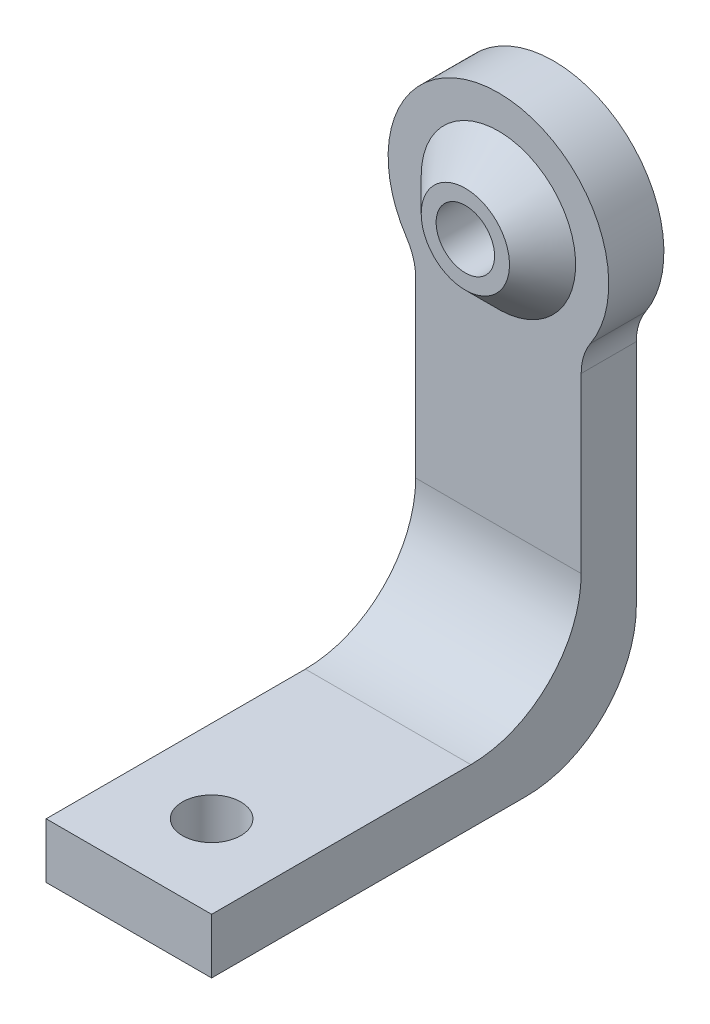
from build123d import *

# Parameters (mm, degrees)
BOSS_EXTRUDE5_DEPTH      = 7.5
BOSS_EXTRUDE5_DEPTH_BACK = 7.5
SKETCH8_W                = 33.5
SKETCH8_H                = 5
SKETCH9_R                = 10
BOSS_EXTRUDE6_DEPTH      = 5
SKETCH11_R               = 2.65
CUT_EXTRUDE7_DEPTH       = 5
SKETCH12_R               = 4
SKETCH12_R_2             = 2.65
BOSS_EXTRUDE7_DEPTH      = 3
CHAMFER1_SIZE            = 3
FILLET1_R                = 10
FILLET2_R                = 5
SKETCH13_R               = 2.65
CUT_EXTRUDE8_DEPTH       = 50
SKETCH14_R               = 4
SKETCH14_R_2             = 2.65
BOSS_EXTRUDE8_DEPTH      = 3
CHAMFER2_SIZE            = 3


with BuildPart() as part:
    # Sketch8 → Boss-Extrude5 (new, two sides: drawn at the far end of the back side and taken through both)
    with BuildSketch(Plane.ZY.offset(-BOSS_EXTRUDE5_DEPTH_BACK)):
        Rectangle(SKETCH8_W, SKETCH8_H)
        Polygon((-16.75, -2.5), (-16.75, 2.5), (-16.75, 41.5), (-21.75, 41.5), (-21.75, -2.5), align=None)
    extrude(amount=BOSS_EXTRUDE5_DEPTH + BOSS_EXTRUDE5_DEPTH_BACK)

    # Sketch9 → Boss-Extrude6 (add)
    with BuildSketch(Plane.XY.offset(-16.75)):
        with Locations((0, 36.5)):
            Circle(SKETCH9_R)
    extrude(amount=-BOSS_EXTRUDE6_DEPTH)

    # Sketch11 → Cut-Extrude7 (cut)
    with BuildSketch(Plane(origin=(0, 0, -21.75), x_dir=(-1, 0, 0), z_dir=(0, 0, -1))):
        with Locations((0, 36.5)):
            Circle(SKETCH11_R)
    extrude(amount=-CUT_EXTRUDE7_DEPTH, mode=Mode.SUBTRACT)

    # Sketch12 → Boss-Extrude7 (add)
    with BuildSketch(Plane.XY.offset(-16.75)):
        with Locations((0, 36.5)):
            Circle(SKETCH12_R)
        with Locations(Location((0, 36.5, 0), (0, 0, 180))):
            Circle(SKETCH12_R_2, mode=Mode.SUBTRACT)
    extrude(amount=BOSS_EXTRUDE7_DEPTH)

    # Chamfer1
    chamfer1_edges = [part.edges().sort_by_distance(p)[0] for p in [
        (-4, 36.5, -16.75),
    ]]
    chamfer(chamfer1_edges, length=CHAMFER1_SIZE - 0.0001)  # a hair under: the kernel refuses the full size

    # Fillet1
    fillet1_edges = [part.edges().sort_by_distance(p)[0] for p in [
        (0, -2.5, -21.75),
        (0, 2.5, -16.75),
    ]]
    fillet(fillet1_edges, radius=FILLET1_R)

    # Fillet2
    fillet2_edges = [part.edges().sort_by_distance(p)[0] for p in [
        (-7.5, 29.885621722, -19.25),
        (7.5, 29.885621722, -19.25),
    ]]
    fillet(fillet2_edges, radius=FILLET2_R)

    # Sketch13 → Cut-Extrude8 (cut)
    with BuildSketch(Plane(origin=(0, 2.5, 0), x_dir=(1, 0, 0), z_dir=(0, 1, 0))):
        with Locations(Location((0, -9.25, 0), (0, 0, 270))):
            Circle(SKETCH13_R)
    extrude(amount=-CUT_EXTRUDE8_DEPTH, mode=Mode.SUBTRACT)

    # Sketch14 → Boss-Extrude8 (add)
    with BuildSketch(Plane.XZ.offset(2.5)):
        with Locations(Location((0, 9.25, 0), (0, 0, 270))):
            Circle(SKETCH14_R)
        with Locations(Location((0, 9.25, 0), (0, 0, 90))):
            Circle(SKETCH14_R_2, mode=Mode.SUBTRACT)
    extrude(amount=BOSS_EXTRUDE8_DEPTH)

    # Chamfer2
    chamfer2_edges = [part.edges().sort_by_distance(p)[0] for p in [
        (0, -2.5, 13.25),
    ]]
    chamfer(chamfer2_edges, length=CHAMFER2_SIZE - 0.0001)  # a hair under: the kernel refuses the full size


solid = part.part
